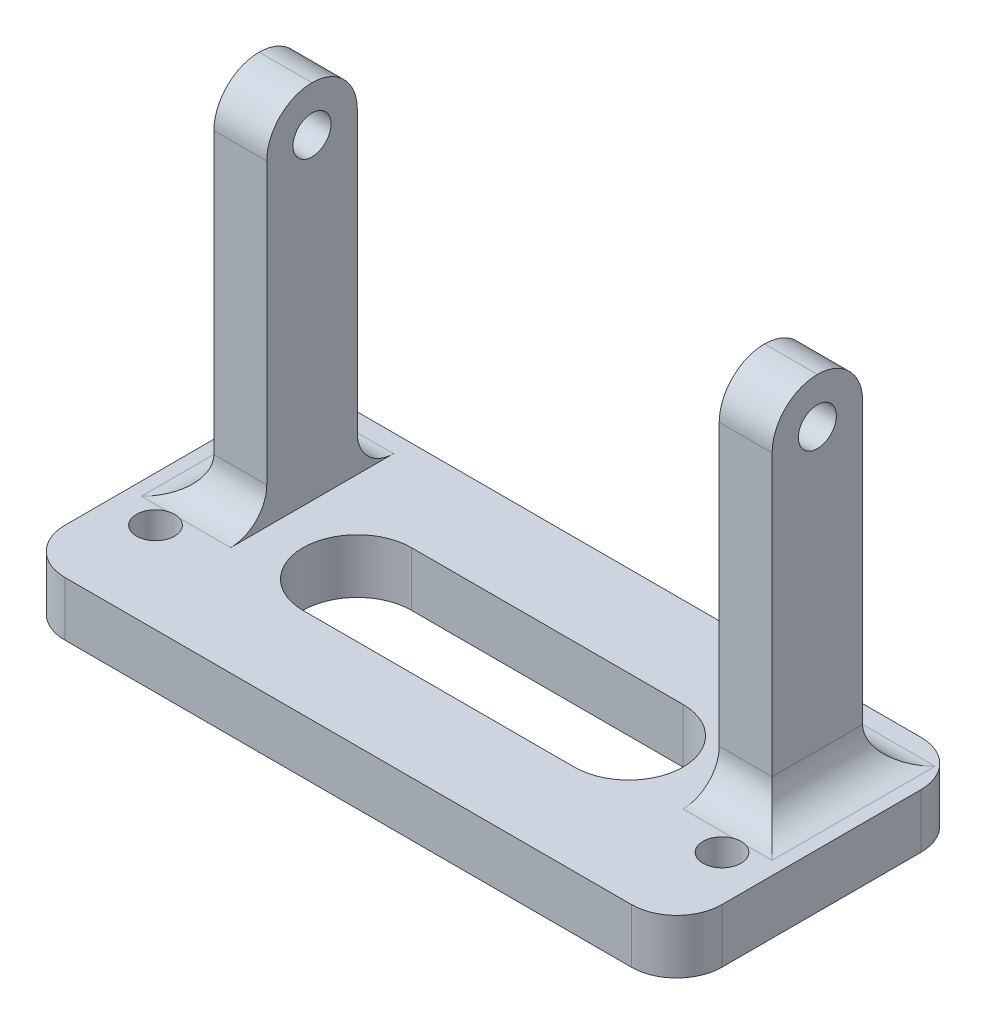
from build123d import *

# Parameters (mm, degrees)
DODANIE_WYCI_GNI_CIE1_DEPTH = 5
DODANIE_WYCI_GNI_CIE4_DEPTH = 8
DODANIE_WYCI_GNI_CIE5_DEPTH = 3
SZKIC8_R                    = 1.05
WYTNIJ_WYCI_GNI_CIE1_DEPTH  = 38.825793195
SZKIC9_R                    = 1.05
WYTNIJ_WYCI_GNI_CIE2_DEPTH  = 39.000906522
ZAOKR_GLENIE1_R             = 2.5
ZAOKR_GLENIE2_R             = 2.5
ZAOKR_GLENIE3_R             = 2
WYTNIJ_WYCI_GNI_CIE3_DEPTH  = 38.825793195


# Some blends are built 0.0001 mm under size
with BuildPart() as part:
    # Szkic1 → Dodanie-wyciągnięcie1 (new body)
    with BuildSketch(Plane.XY):
        Polygon((6.943729276, -9.167385079), (6.943729276, -12.167385079), (-29.356270724, -12.167385079), (-29.356270724, -9.167385079), (-26.62744343, -9.167385079), (-26.62744343, 10.832614921), (-23.706270724, 10.832614921), (-23.706270724, -9.167385079), (1.293729276, -9.167385079), (1.293729276, 10.832614921), (4.214901981, 10.832614921), (4.214901981, -9.167385079), align=None)
    extrude(amount=DODANIE_WYCI_GNI_CIE1_DEPTH)

    # Szkic5 → Dodanie-wyciągnięcie4 (add)
    with BuildSketch(Plane.XY.offset(5)):
        Polygon((-26.62744343, -9.167385079), (-23.706270724, -9.167385079), (1.293729276, -9.167385079), (4.214901981, -9.167385079), (6.943729276, -9.167385079), (6.943729276, -12.167385079), (-29.356270724, -12.167385079), (-29.356270724, -9.167385079), align=None)
    extrude(amount=DODANIE_WYCI_GNI_CIE4_DEPTH)

    # Szkic7 → Dodanie-wyciągnięcie5 (add)
    with BuildSketch(Plane(origin=(0, 0, 0), x_dir=(-1, 0, 0), z_dir=(0, 0, -1))):
        Polygon((-4.214901981, -9.167385079), (-1.293729276, -9.167385079), (23.706270724, -9.167385079), (26.62744343, -9.167385079), (29.356270724, -9.167385079), (29.356270724, -12.167385079), (-6.943729276, -12.167385079), (-6.943729276, -9.167385079), align=None)
    extrude(amount=DODANIE_WYCI_GNI_CIE5_DEPTH)

    # Szkic8 → Wytnij-wyciągnięcie1 (cut, through all)
    with BuildSketch(Plane(origin=(0, -9.167385079, 0), x_dir=(1, 0, 0), z_dir=(0, 1, 0))):
        with Locations(Location((4.446418634, -8, 0), (0, 0, 180))):
            Circle(SZKIC8_R)
        with Locations(Location((-26.853581366, -8, 0), (0, 0, 180))):
            Circle(SZKIC8_R)
    extrude(amount=-WYTNIJ_WYCI_GNI_CIE1_DEPTH, mode=Mode.SUBTRACT)

    # Szkic9 → Wytnij-wyciągnięcie2 (cut, through all)
    with BuildSketch(Plane.ZY.offset(26.62744343)):
        with Locations((2.5, 8.332614921)):
            Circle(SZKIC9_R)
    extrude(amount=-WYTNIJ_WYCI_GNI_CIE2_DEPTH, mode=Mode.SUBTRACT)

    # Zaokrąglenie1
    zaokr_glenie1_edges = [part.edges().sort_by_distance(p)[0] for p in [
        (-29.356270724, -10.667385079, 13),
        (6.943729276, -10.667385079, 13),
        (6.943729276, -10.667385079, -3),
        (-29.356270724, -10.667385079, -3),
    ]]
    fillet(zaokr_glenie1_edges, radius=ZAOKR_GLENIE1_R)

    # Zaokrąglenie2
    zaokr_glenie2_edges = [part.edges().sort_by_distance(p)[0] for p in [
        (-25.166857077, 10.832614921, 5),
        (-25.166857077, 10.832614921, 0),
        (2.754315628, 10.832614921, 5),
        (2.754315628, 10.832614921, 0),
    ]]
    fillet(zaokr_glenie2_edges, radius=ZAOKR_GLENIE2_R - 0.0001)  # a hair under: the kernel refuses the full size

    # Zaokrąglenie3
    # the kernel refuses this fillet: 2 mm, written as the material it adds along each edge
    with BuildSketch(Plane(origin=(4.214901981, -9.167385079, 0), x_dir=(1, 0, 0), z_dir=(0, 0, 1))) as zaokr_glenie3_piece_1:
        with BuildLine():
            CenterArc((ZAOKR_GLENIE3_R, ZAOKR_GLENIE3_R), ZAOKR_GLENIE3_R, 180, 90)
            Line((0, ZAOKR_GLENIE3_R), (0, 0))
            Line((0, 0), (ZAOKR_GLENIE3_R, 0))
        make_face()
    extrude(amount=5)
    with BuildSketch(Plane(origin=(-26.62744343, -9.167385079, 0), x_dir=(-1, 0, 0), z_dir=(0, 0, 1))) as zaokr_glenie3_piece_2:
        with BuildLine():
            CenterArc((ZAOKR_GLENIE3_R, -ZAOKR_GLENIE3_R), ZAOKR_GLENIE3_R, 90, 90)
            Line((0, -ZAOKR_GLENIE3_R), (0, 0))
            Line((0, 0), (ZAOKR_GLENIE3_R, 0))
        make_face()
    extrude(amount=5)
    with BuildSketch(Plane(origin=(-23.706270724, -9.167385079, 5), x_dir=(0, 1, 0), z_dir=(-1, 0, 0))) as zaokr_glenie3_piece_3_section:
        with BuildLine():
            CenterArc((ZAOKR_GLENIE3_R, -ZAOKR_GLENIE3_R), ZAOKR_GLENIE3_R, 90, 90)
            Line((0, -ZAOKR_GLENIE3_R), (0, 0))
            Line((0, 0), (ZAOKR_GLENIE3_R, 0))
        make_face()
    zaokr_glenie3_piece_3 = extrude(amount=2.921172706, mode=Mode.PRIVATE)
    zaokr_glenie3_piece_3 = zaokr_glenie3_piece_3 - Plane(origin=(-26.853581366, -8.714586813, 8), x_dir=(-1, 0, 0), z_dir=(0, 1, 0)) * Cylinder(1.05, 14, mode=Mode.PRIVATE)
    add(zaokr_glenie3_piece_3)
    with BuildSketch(Plane(origin=(4.214901981, -9.167385079, 5), x_dir=(0, 0, 1), z_dir=(-1, 0, 0))) as zaokr_glenie3_piece_4_section:
        with BuildLine():
            CenterArc((ZAOKR_GLENIE3_R, ZAOKR_GLENIE3_R), ZAOKR_GLENIE3_R, 180, 90)
            Line((0, ZAOKR_GLENIE3_R), (0, 0))
            Line((0, 0), (ZAOKR_GLENIE3_R, 0))
        make_face()
    zaokr_glenie3_piece_4 = extrude(amount=2.921172706, mode=Mode.PRIVATE)
    zaokr_glenie3_piece_4 = zaokr_glenie3_piece_4 - Plane(origin=(4.446418634, -8.714587659, 8), x_dir=(-1, 0, 0), z_dir=(0, 1, 0)) * Cylinder(1.05, 14, mode=Mode.PRIVATE)
    add(zaokr_glenie3_piece_4)
    with BuildSketch(Plane(origin=(1.293729276, -9.167385079, 0), x_dir=(0, 0, -1), z_dir=(1, 0, 0))) as zaokr_glenie3_piece_5:
        with BuildLine():
            CenterArc((ZAOKR_GLENIE3_R, ZAOKR_GLENIE3_R), ZAOKR_GLENIE3_R, 180, 90)
            Line((0, ZAOKR_GLENIE3_R), (0, 0))
            Line((0, 0), (ZAOKR_GLENIE3_R, 0))
        make_face()
    extrude(amount=2.921172706)
    with BuildSketch(Plane(origin=(-26.62744343, -9.167385079, 0), x_dir=(0, 1, 0), z_dir=(1, 0, 0))) as zaokr_glenie3_piece_6:
        with BuildLine():
            CenterArc((ZAOKR_GLENIE3_R, -ZAOKR_GLENIE3_R), ZAOKR_GLENIE3_R, 90, 90)
            Line((0, -ZAOKR_GLENIE3_R), (0, 0))
            Line((0, 0), (ZAOKR_GLENIE3_R, 0))
        make_face()
    extrude(amount=2.921172706)
    with BuildSketch(Plane(origin=(4.214901981, -9.167385079, -5), x_dir=(1, 0, 0), z_dir=(0, 0, 1))) as zaokr_glenie3_piece_7a_section:
        with BuildLine():
            CenterArc((ZAOKR_GLENIE3_R, ZAOKR_GLENIE3_R), ZAOKR_GLENIE3_R, 180, 90)
            Line((0, ZAOKR_GLENIE3_R), (0, 0))
            Line((0, 0), (ZAOKR_GLENIE3_R, 0))
        make_face()
    zaokr_glenie3_piece_7a = extrude(amount=10, mode=Mode.PRIVATE)
    zaokr_glenie3_piece_7a = zaokr_glenie3_piece_7a & Plane(origin=(4.443729276, -8.70886388, -0.5), x_dir=(1, 0, 0), z_dir=(0, 1, 0)) * Cylinder(2.5, 28, mode=Mode.PRIVATE)
    zaokr_glenie3_piece_7a = split(zaokr_glenie3_piece_7a, bisect_by=Plane(origin=(4.654982767, -8.70886388, 0), z_dir=(0, 0, -1)), keep=Keep.TOP, mode=Mode.PRIVATE)
    with BuildSketch(Plane(origin=(1.293729276, -9.167385079, 0), x_dir=(0, 0, -1), z_dir=(1, 0, 0))) as zaokr_glenie3_piece_7b_section:
        with BuildLine():
            CenterArc((ZAOKR_GLENIE3_R, ZAOKR_GLENIE3_R), ZAOKR_GLENIE3_R, 180, 90)
            Line((0, ZAOKR_GLENIE3_R), (0, 0))
            Line((0, 0), (ZAOKR_GLENIE3_R, 0))
        make_face()
    zaokr_glenie3_piece_7b = extrude(amount=7.921172706, mode=Mode.PRIVATE)
    zaokr_glenie3_piece_7b = zaokr_glenie3_piece_7b & Plane(origin=(4.443729276, -8.713013539, -0.5), x_dir=(1, 0, 0), z_dir=(0, 1, 0)) * Cylinder(2.5, 24, mode=Mode.PRIVATE)
    zaokr_glenie3_piece_7b = split(zaokr_glenie3_piece_7b, bisect_by=Plane(origin=(4.214901981, -8.713013539, -0.447003407), z_dir=(1, 0, 0)), keep=Keep.TOP, mode=Mode.PRIVATE)
    zaokr_glenie3_piece_7 = zaokr_glenie3_piece_7a & zaokr_glenie3_piece_7b
    add(zaokr_glenie3_piece_7)
    with BuildSketch(Plane(origin=(4.214901981, -9.167385079, 0), x_dir=(1, 0, 0), z_dir=(0, 0, 1))) as zaokr_glenie3_piece_8a_section:
        with BuildLine():
            CenterArc((ZAOKR_GLENIE3_R, ZAOKR_GLENIE3_R), ZAOKR_GLENIE3_R, 180, 90)
            Line((0, ZAOKR_GLENIE3_R), (0, 0))
            Line((0, 0), (ZAOKR_GLENIE3_R, 0))
        make_face()
    zaokr_glenie3_piece_8a = extrude(amount=10, mode=Mode.PRIVATE)
    zaokr_glenie3_piece_8a = zaokr_glenie3_piece_8a - Plane(origin=(4.446418634, -9.113524986, 8), x_dir=(-1, 0, 0), z_dir=(0, 1, 0)) * Cylinder(1.05, 28, mode=Mode.PRIVATE)
    zaokr_glenie3_piece_8a = split(zaokr_glenie3_piece_8a, bisect_by=Plane(origin=(5.693435365, -9.113524986, 5), z_dir=(0, 0, 1)), keep=Keep.TOP, mode=Mode.PRIVATE)
    with BuildSketch(Plane(origin=(9.214901981, -9.167385079, 5), x_dir=(0, 0, 1), z_dir=(-1, 0, 0))) as zaokr_glenie3_piece_8b_section:
        with BuildLine():
            CenterArc((ZAOKR_GLENIE3_R, ZAOKR_GLENIE3_R), ZAOKR_GLENIE3_R, 180, 90)
            Line((0, ZAOKR_GLENIE3_R), (0, 0))
            Line((0, 0), (ZAOKR_GLENIE3_R, 0))
        make_face()
    zaokr_glenie3_piece_8b = extrude(amount=7.921172706, mode=Mode.PRIVATE)
    zaokr_glenie3_piece_8b = split(zaokr_glenie3_piece_8b, bisect_by=Plane(origin=(6.943729276, -8.714456285, 5.452342783), z_dir=(-1, 0, 0)), keep=Keep.TOP, mode=Mode.PRIVATE)
    zaokr_glenie3_piece_8b = zaokr_glenie3_piece_8b - Plane(origin=(4.446418634, -8.714456285, 8), x_dir=(-1, 0, 0), z_dir=(0, 1, 0)) * Cylinder(1.05, 24, mode=Mode.PRIVATE)
    zaokr_glenie3_piece_8b = split(zaokr_glenie3_piece_8b, bisect_by=Plane(origin=(4.214901981, -8.714456285, 5.452342783), z_dir=(1, 0, 0)), keep=Keep.TOP, mode=Mode.PRIVATE)
    zaokr_glenie3_piece_8 = zaokr_glenie3_piece_8a & zaokr_glenie3_piece_8b
    add(zaokr_glenie3_piece_8)
    with BuildSketch(Plane(origin=(-31.62744343, -9.167385079, 0), x_dir=(0, 1, 0), z_dir=(1, 0, 0))) as zaokr_glenie3_piece_9a_section:
        with BuildLine():
            CenterArc((ZAOKR_GLENIE3_R, -ZAOKR_GLENIE3_R), ZAOKR_GLENIE3_R, 90, 90)
            Line((0, -ZAOKR_GLENIE3_R), (0, 0))
            Line((0, 0), (ZAOKR_GLENIE3_R, 0))
        make_face()
    zaokr_glenie3_piece_9a = extrude(amount=7.921172706, mode=Mode.PRIVATE)
    zaokr_glenie3_piece_9a = split(zaokr_glenie3_piece_9a, bisect_by=Plane(origin=(-26.62744343, -8.713013524, -0.447003529), z_dir=(-1, 0, 0)), keep=Keep.TOP, mode=Mode.PRIVATE)
    zaokr_glenie3_piece_9a = zaokr_glenie3_piece_9a & Plane(origin=(-26.856270724, -8.713013524, -0.5), x_dir=(0, 0, -1), z_dir=(0, -1, 0)) * Cylinder(2.5, 24, mode=Mode.PRIVATE)
    with BuildSketch(Plane(origin=(-26.62744343, -9.167385079, -5), x_dir=(-1, 0, 0), z_dir=(0, 0, 1))) as zaokr_glenie3_piece_9b_section:
        with BuildLine():
            CenterArc((ZAOKR_GLENIE3_R, -ZAOKR_GLENIE3_R), ZAOKR_GLENIE3_R, 90, 90)
            Line((0, -ZAOKR_GLENIE3_R), (0, 0))
            Line((0, 0), (ZAOKR_GLENIE3_R, 0))
        make_face()
    zaokr_glenie3_piece_9b = extrude(amount=10, mode=Mode.PRIVATE)
    zaokr_glenie3_piece_9b = split(zaokr_glenie3_piece_9b, bisect_by=Plane(origin=(-27.067524529, -8.708863922, 0), z_dir=(0, 0, -1)), keep=Keep.TOP, mode=Mode.PRIVATE)
    zaokr_glenie3_piece_9b = zaokr_glenie3_piece_9b & Plane(origin=(-26.856270724, -8.708863922, -0.5), x_dir=(0, 0, -1), z_dir=(0, -1, 0)) * Cylinder(2.5, 29, mode=Mode.PRIVATE)
    zaokr_glenie3_piece_9 = zaokr_glenie3_piece_9a & zaokr_glenie3_piece_9b
    add(zaokr_glenie3_piece_9)
    with BuildSketch(Plane(origin=(-23.706270724, -9.167385079, 5), x_dir=(0, 1, 0), z_dir=(-1, 0, 0))) as zaokr_glenie3_piece_10a_section:
        with BuildLine():
            CenterArc((ZAOKR_GLENIE3_R, -ZAOKR_GLENIE3_R), ZAOKR_GLENIE3_R, 90, 90)
            Line((0, -ZAOKR_GLENIE3_R), (0, 0))
            Line((0, 0), (ZAOKR_GLENIE3_R, 0))
        make_face()
    zaokr_glenie3_piece_10a = extrude(amount=7.921172706, mode=Mode.PRIVATE)
    zaokr_glenie3_piece_10a = split(zaokr_glenie3_piece_10a, bisect_by=Plane(origin=(-26.62744343, -8.714457191, 5.452345725), z_dir=(-1, 0, 0)), keep=Keep.TOP, mode=Mode.PRIVATE)
    zaokr_glenie3_piece_10a = split(zaokr_glenie3_piece_10a, bisect_by=Plane(origin=(-29.356270724, -8.714457191, 5.452345725), z_dir=(1, 0, 0)), keep=Keep.TOP, mode=Mode.PRIVATE)
    zaokr_glenie3_piece_10a = zaokr_glenie3_piece_10a - Plane(origin=(-26.853581366, -8.714457191, 8), x_dir=(-1, 0, 0), z_dir=(0, 1, 0)) * Cylinder(1.05, 24, mode=Mode.PRIVATE)
    with BuildSketch(Plane(origin=(-26.62744343, -9.167385079, 0), x_dir=(-1, 0, 0), z_dir=(0, 0, 1))) as zaokr_glenie3_piece_10b_section:
        with BuildLine():
            CenterArc((ZAOKR_GLENIE3_R, -ZAOKR_GLENIE3_R), ZAOKR_GLENIE3_R, 90, 90)
            Line((0, -ZAOKR_GLENIE3_R), (0, 0))
            Line((0, 0), (ZAOKR_GLENIE3_R, 0))
        make_face()
    zaokr_glenie3_piece_10b = extrude(amount=10, mode=Mode.PRIVATE)
    zaokr_glenie3_piece_10b = split(zaokr_glenie3_piece_10b, bisect_by=Plane(origin=(-28.105975739, -9.113528996, 5), z_dir=(0, 0, 1)), keep=Keep.TOP, mode=Mode.PRIVATE)
    zaokr_glenie3_piece_10b = zaokr_glenie3_piece_10b - Plane(origin=(-26.853581366, -9.113528996, 8), x_dir=(-1, 0, 0), z_dir=(0, 1, 0)) * Cylinder(1.05, 29, mode=Mode.PRIVATE)
    zaokr_glenie3_piece_10 = zaokr_glenie3_piece_10a & zaokr_glenie3_piece_10b
    add(zaokr_glenie3_piece_10)

    # Szkic10 → Wytnij-wyciągnięcie3 (cut, through all)
    with BuildSketch(Plane(origin=(0, -9.167385079, 0), x_dir=(1, 0, 0), z_dir=(0, 1, 0))):
        with BuildLine():
            Line((-18.706270724, -8), (-3.706270724, -8))
            ThreePointArc((-3.706270724, -8), (-0.706270724, -5), (-3.706270724, -2))
            Line((-3.706270724, -2), (-18.706270724, -2))
            ThreePointArc((-18.706270724, -2), (-21.706270724, -5), (-18.706270724, -8))
        make_face()
    extrude(amount=-WYTNIJ_WYCI_GNI_CIE3_DEPTH, mode=Mode.SUBTRACT)


solid = part.part
